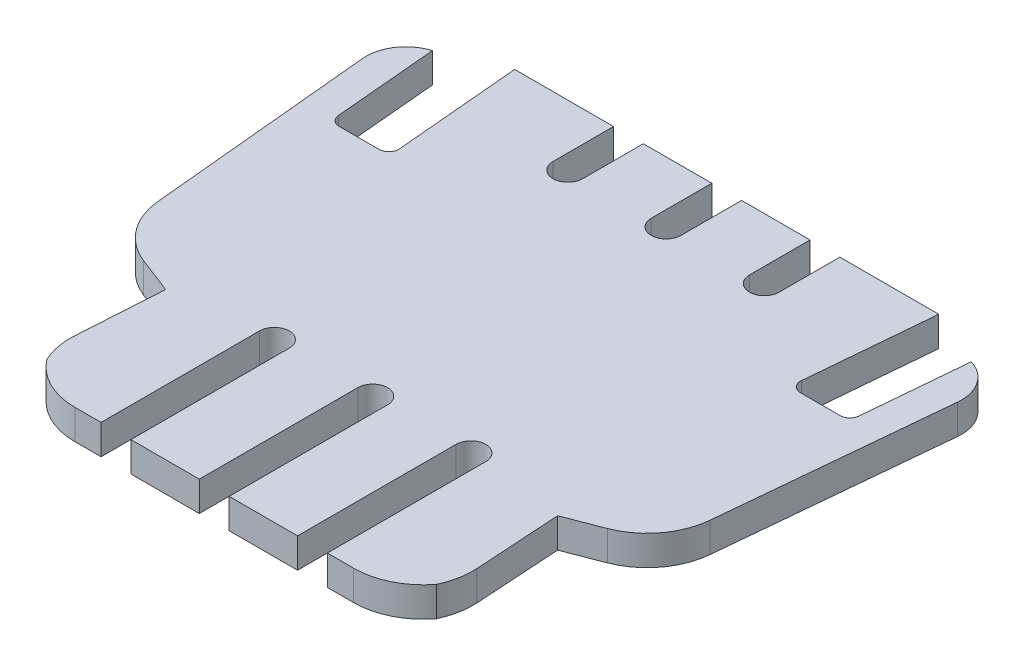
from build123d import *

# Parameters (mm, degrees)
BOSS_EXTRUDE1_DEPTH = 3
FILLET1_R           = 4
FILLET2_R           = 1
FILLET3_R           = 7


with BuildPart() as part:
    # Sketch1 → Boss-Extrude1 (new body)
    with BuildSketch(Plane(origin=(0, 0, 0), x_dir=(1, 0, 0), z_dir=(0, 1, 0))):
        with BuildLine():
            Line((-1.5, 6.1), (-1.5, 0))
            ThreePointArc((-1.5, 0), (0, -1.5), (1.5, 0))
            Line((1.5, 0), (1.5, 6.1))
            Line((1.5, 6.1), (8.39, 6.1))
            Line((8.39, 6.1), (8.39, 0))
            ThreePointArc((8.39, 0), (9.89, -1.5), (11.39, 0))
            Line((11.39, 0), (11.39, 6.1))
            Line((11.39, 6.1), (21.345, 6.1))
            Line((21.345, 6.1), (20.121226415, -7.7))
            Line((20.121226415, -7.7), (26.121226415, -7.7))
            Line((26.121226415, -7.7), (27.123301887, 3.6))
            Line((27.123301887, 3.6), (30.353301887, 3.6))
            Line((30.353301887, 3.6), (27.375, -27.7))
            Line((27.375, -27.7), (19.725, -30.65))
            Line((19.725, -30.65), (20.405, -41.49))
            Line((20.405, -41.49), (17.97, -45.49))
            Line((17.97, -45.49), (11.39, -45.49))
            Line((11.39, -45.49), (11.39, -29.54))
            ThreePointArc((11.39, -29.54), (9.89, -28.04), (8.39, -29.54))
            Line((8.39, -29.54), (8.39, -45.49))
            Line((8.39, -45.49), (1.5, -45.49))
            Line((1.5, -45.49), (1.5, -29.54))
            ThreePointArc((1.5, -29.54), (0, -28.04), (-1.5, -29.54))
            Line((-1.5, -29.54), (-1.5, -45.49))
            Line((-1.5, -45.49), (-8.39, -45.49))
            Line((-8.39, -45.49), (-8.39, -29.54))
            ThreePointArc((-8.39, -29.54), (-9.89, -28.04), (-11.39, -29.54))
            Line((-11.39, -29.54), (-11.39, -45.49))
            Line((-11.39, -45.49), (-17.97, -45.49))
            Line((-17.97, -45.49), (-20.405, -41.49))
            Line((-20.405, -41.49), (-19.725, -30.65))
            Line((-19.725, -30.65), (-27.375, -27.7))
            Line((-27.375, -27.7), (-30.353301887, 3.6))
            Line((-30.353301887, 3.6), (-27.123301887, 3.6))
            Line((-27.123301887, 3.6), (-26.121226415, -7.7))
            Line((-26.121226415, -7.7), (-20.121226415, -7.7))
            Line((-20.121226415, -7.7), (-21.345, 6.1))
            Line((-21.345, 6.1), (-11.39, 6.1))
            Line((-11.39, 6.1), (-11.39, 0))
            ThreePointArc((-11.39, 0), (-9.89, -1.5), (-8.39, 0))
            Line((-8.39, 0), (-8.39, 6.1))
            Line((-8.39, 6.1), (-1.5, 6.1))
        make_face()
    extrude(amount=BOSS_EXTRUDE1_DEPTH)

    # Fillet1
    # the kernel refuses this fillet: 4 mm, written as the material it takes off along each edge
    with BuildSketch(Plane(origin=(-30.353301887, -10.570685878, -3.6), x_dir=(0.09472555048973348, 0, 0.9955034254508706), z_dir=(0, 1, 0))) as fillet1_piece_1:
        with BuildLine():
            CenterArc((4.228274351, 4), FILLET1_R, 191.310800098, 78.689199902)
            Line((0.305963528, 3.215476064), (0.227517312, 3.199785585))
            ThreePointArc((0.227517312, 3.199785585), (0.07334149, 1.615316076), (-0.079640274, 0.007578044))
            Line((-0.079640274, 0.007578044), (0, -0.08))
            Line((0, -0.08), (4.228274351, -0.08))
            Line((4.228274351, -0.08), (4.228274351, 0))
        make_face()
    extrude(amount=24.141371757, mode=Mode.SUBTRACT)
    with BuildSketch(Plane(origin=(30.353301887, -10.570685878, -3.6), x_dir=(-1, 0, 0), z_dir=(0, 1, 0))) as fillet1_piece_2:
        with BuildLine():
            CenterArc((4.382539317, 3.830359399), FILLET1_R, 174.564476221, 78.689199902)
            Line((0.400525616, 4.2092616), (0.320885342, 4.216839645))
            Line((0.320885342, 4.216839645), (-0.079640274, 0.007578044))
            Line((-0.079640274, 0.007578044), (0, -0.08))
            ThreePointArc((0, -0.08), (1.615, -0.08), (3.206949214, -0.076607188))
            Line((3.206949214, -0.076607188), (3.23, 0))
        make_face()
    extrude(amount=24.141371757, mode=Mode.SUBTRACT)

    # Fillet2
    fillet2_edges = [part.edges().sort_by_distance(p)[0] for p in [
        (20.121226415, 1.5, 7.7),
        (26.121226415, 1.5, 7.7),
        (-26.121226415, 1.5, 7.7),
        (-20.121226415, 1.5, 7.7),
    ]]
    fillet(fillet2_edges, radius=FILLET2_R)

    # Fillet3
    # the kernel refuses this fillet: 7 mm, written as the material it takes off along each edge
    with BuildSketch(Plane(origin=(-17.97, -9.834409558, 45.49), x_dir=(-0.5199808190603072, 0, -0.8541779368547118), z_dir=(0, 1, 0)), Plane(origin=(17.97, -9.834409558, 45.49), x_dir=(-1, 0, 0), z_dir=(0, 1, 0))) as fillet3_piece_1:
        with BuildLine():
            CenterArc((FILLET3_R * 0.561966260458, -FILLET3_R), FILLET3_R, 90, 58.669035113)
            Line((-FILLET3_R * 0.292211676397, -FILLET3_R * 0.48001918094), (0, 0))
            Line((0, 0), (FILLET3_R * 0.561966260458, 0))
        make_face()
    extrude(amount=22.668819116, mode=Mode.SUBTRACT)
    with BuildSketch(Plane(origin=(-20.405, -5.504377364, 41.49), x_dir=(0.0626075637538876, 0, -0.9980382221943221), z_dir=(0, 1, 0)), Plane(origin=(20.405, -5.504377364, 41.49), x_dir=(-0.5199808190603077, 0, 0.8541779368547114), z_dir=(0, 1, 0))) as fillet3_piece_2:
        with BuildLine():
            CenterArc((FILLET3_R * 0.314535849376, -FILLET3_R), FILLET3_R, 90, 34.920461628)
            Line((-FILLET3_R * 0.257902882493, -FILLET3_R * 0.180052502744), (0, 0))
            Line((0, 0), (FILLET3_R * 0.314535849376, 0))
        make_face()
    extrude(amount=14.008754728, mode=Mode.SUBTRACT)
    with BuildSketch(Plane(origin=(-27.375, -10.824428121, 27.7), x_dir=(-0.09472555048973366, 0, -0.9955034254508704), z_dir=(0, 1, 0)), Plane(origin=(27.375, -10.824428121, 27.7), x_dir=(-0.9330309060396333, 0, 0.3597962317407744), z_dir=(0, 1, 0))) as fillet3_piece_3:
        with BuildLine():
            CenterArc((FILLET3_R * 0.61853874979, -FILLET3_R), FILLET3_R, 90, 63.476793772)
            Line((-FILLET3_R * 0.276214817108, -FILLET3_R * 0.553439752639), (0, 0))
            Line((0, 0), (FILLET3_R * 0.61853874979, 0))
        make_face()
    extrude(amount=24.648856243, mode=Mode.SUBTRACT)


solid = part.part
